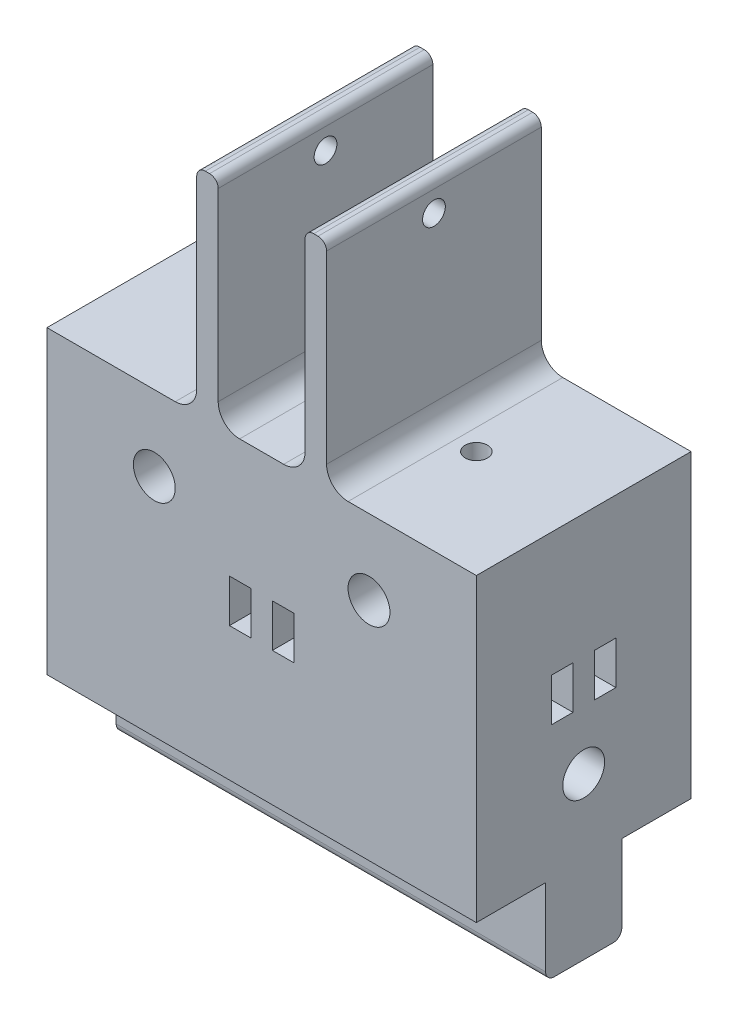
from build123d import *

# Parameters (mm, degrees)
SKETCH1_W               = 100
SKETCH1_H               = 70
BOSS_EXTRUDE1_DEPTH     = 25
CUT_EXTRUDE1_DEPTH      = 79.89866919
CUT_EXTRUDE1_DEPTH_BACK = 79.89866919
SKETCH2_R               = 4.875
CUT_EXTRUDE2_DEPTH      = 109.857705285
CUT_EXTRUDE2_DEPTH_BACK = 109.857705285
SKETCH3_R               = 4.875
SKETCH4_R               = 2.6
CUT_EXTRUDE4_DEPTH      = 20
SKETCH5_W               = 100
SKETCH5_H               = 17.75
BOSS_EXTRUDE2_DEPTH     = 20
FILLET1_R               = 2
SKETCH6_W               = 5
SKETCH6_H               = 50
BOSS_EXTRUDE3_DEPTH     = 50
CUT_EXTRUDE5_DEPTH      = 110.960291151
CUT_EXTRUDE5_DEPTH_BACK = 110.960291151
SKETCH7_R               = 2.65
FILLET2_R               = 5
FILLET3_R               = 2
CUT_EXTRUDE6_DEPTH      = 134.603892178
CUT_EXTRUDE6_DEPTH_BACK = 134.603892178
SKETCH8_W               = 5
SKETCH8_H               = 10
CUT_EXTRUDE7_DEPTH      = 111.566721983
CUT_EXTRUDE7_DEPTH_BACK = 111.566721983
SKETCH9_W               = 5
SKETCH9_H               = 10
FILLET4_R               = 10


with BuildPart() as part:
    # Sketch1 → Boss-Extrude1 (new, symmetric)
    with BuildSketch(Plane.XY):
        Rectangle(SKETCH1_W, SKETCH1_H)
    extrude(amount=BOSS_EXTRUDE1_DEPTH, both=True)

    # Sketch2 → Cut-Extrude1 (cut, two sides: drawn at the far end of the back side and taken through both)
    with BuildSketch(Plane.XY.offset(25).offset(-CUT_EXTRUDE1_DEPTH_BACK)):
        with Locations((25, 17.5)):
            Circle(SKETCH2_R)
        with Locations((-25, 17.5)):
            Circle(SKETCH2_R)
    extrude(amount=CUT_EXTRUDE1_DEPTH + CUT_EXTRUDE1_DEPTH_BACK, mode=Mode.SUBTRACT)

    # Sketch3 → Cut-Extrude2 (cut, two sides: drawn at the far end of the back side and taken through both)
    with BuildSketch(Plane.ZY.offset(50).offset(-CUT_EXTRUDE2_DEPTH_BACK)):
        with Locations((0, -17.5)):
            Circle(SKETCH3_R)
    extrude(amount=CUT_EXTRUDE2_DEPTH + CUT_EXTRUDE2_DEPTH_BACK, mode=Mode.SUBTRACT)

    # Sketch4 → Cut-Extrude4 (cut)
    with BuildSketch(Plane(origin=(0, 35, 0), x_dir=(1, 0, 0), z_dir=(0, 1, 0))):
        with Locations((-25, 0)):
            Circle(SKETCH4_R)
        with Locations((25, 0)):
            Circle(SKETCH4_R)
    extrude(amount=-CUT_EXTRUDE4_DEPTH, mode=Mode.SUBTRACT)

    # Sketch5 → Boss-Extrude2 (add)
    with BuildSketch(Plane.XZ.offset(35)):
        Rectangle(SKETCH5_W, SKETCH5_H)
    extrude(amount=BOSS_EXTRUDE2_DEPTH)

    # Fillet1
    fillet1_edges = [part.edges().sort_by_distance(p)[0] for p in [
        (0, -55, -8.875),
        (0, -55, 8.875),
    ]]
    fillet(fillet1_edges, radius=FILLET1_R)

    # Sketch6 → Boss-Extrude3 (add)
    with BuildSketch(Plane(origin=(0, 35, 0), x_dir=(1, 0, 0), z_dir=(0, 1, 0))):
        with Locations((-12.625, 0)):
            Rectangle(SKETCH6_W, SKETCH6_H)
        with Locations((12.625, 0)):
            Rectangle(SKETCH6_W, SKETCH6_H)
    extrude(amount=BOSS_EXTRUDE3_DEPTH)

    # Sketch7 → Cut-Extrude5 (cut, two sides: drawn at the far end of the back side and taken through both)
    with BuildSketch(Plane(origin=(15.125, 0, 0), x_dir=(0, 0, -1), z_dir=(1, 0, 0)).offset(-CUT_EXTRUDE5_DEPTH_BACK)):
        with Locations((0, 78.15)):
            Circle(SKETCH7_R)
    extrude(amount=CUT_EXTRUDE5_DEPTH + CUT_EXTRUDE5_DEPTH_BACK, mode=Mode.SUBTRACT)

    # Fillet2
    fillet2_edges = [part.edges().sort_by_distance(p)[0] for p in [
        (-15.125, 35, 0),
        (-10.125, 35, 0),
        (10.125, 35, 0),
        (15.125, 35, 0),
    ]]
    fillet(fillet2_edges, radius=FILLET2_R)

    # Fillet3
    fillet3_edges = [part.edges().sort_by_distance(p)[0] for p in [
        (15.125, 85, 0),
        (10.125, 85, 0),
        (-10.125, 85, 0),
        (-15.125, 85, 0),
    ]]
    fillet(fillet3_edges, radius=FILLET3_R)

    # Sketch8 → Cut-Extrude6 (cut, two sides: drawn at the far end of the back side and taken through both)
    with BuildSketch(Plane.ZY.offset(50).offset(-CUT_EXTRUDE6_DEPTH_BACK)):
        with Locations((-5, 1.15)):
            Rectangle(SKETCH8_W, SKETCH8_H)
        with Locations((5, 1.15)):
            Rectangle(SKETCH8_W, SKETCH8_H)
    extrude(amount=CUT_EXTRUDE6_DEPTH + CUT_EXTRUDE6_DEPTH_BACK, mode=Mode.SUBTRACT)

    # Sketch9 → Cut-Extrude7 (cut, two sides: drawn at the far end of the back side and taken through both)
    with BuildSketch(Plane.XY.offset(25).offset(-CUT_EXTRUDE7_DEPTH_BACK)):
        with Locations((-5, 1.15)):
            Rectangle(SKETCH9_W, SKETCH9_H)
        with Locations((5, 1.15)):
            Rectangle(SKETCH9_W, SKETCH9_H)
    extrude(amount=CUT_EXTRUDE7_DEPTH + CUT_EXTRUDE7_DEPTH_BACK, mode=Mode.SUBTRACT)

    # Fillet4
    fillet4_edges = [part.edges().sort_by_distance(p)[0] for p in [
        (7.5, 1.15, 7.5),
        (7.5, 1.15, -7.5),
        (-7.5, 1.15, -7.5),
        (-7.5, 1.15, 7.5),
    ]]
    fillet(fillet4_edges, radius=FILLET4_R)


solid = part.part
